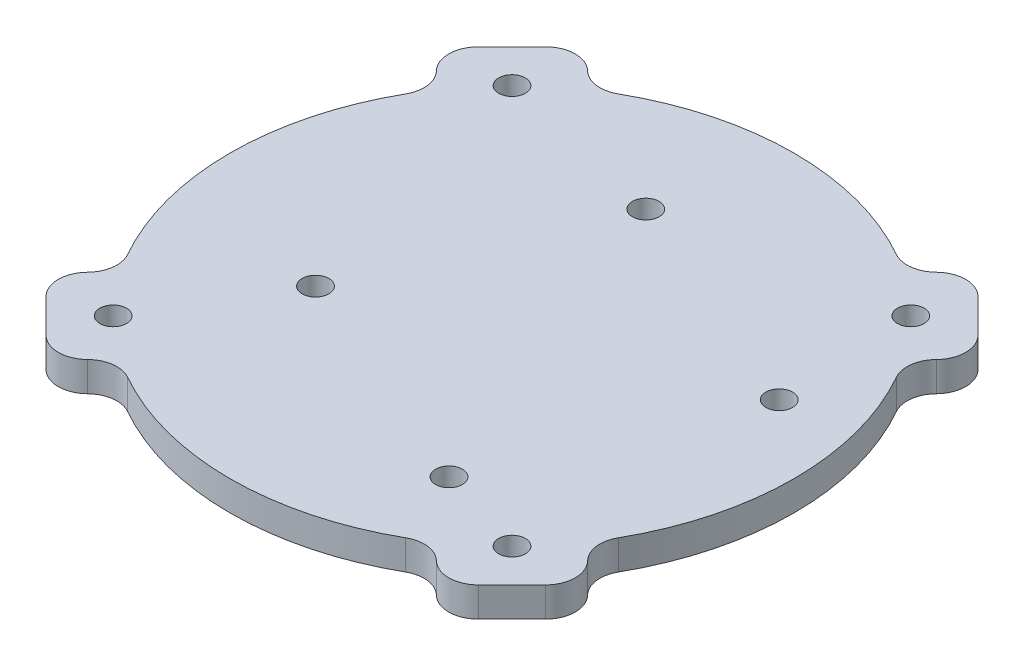
from build123d import *

# Parameters (mm, degrees)
SKETCH3_R           = 2.25
BOSS_EXTRUDE2_DEPTH = 5
FILLET2_R           = 5
SKETCH4_R           = 2.25
CUT_EXTRUDE1_DEPTH  = 68.360968075


with BuildPart() as part:
    # Sketch3 → Boss-Extrude2 (new body)
    with BuildSketch(Plane(origin=(0, 0, 0), x_dir=(1, 0, 0), z_dir=(0, 1, 0))):
        with BuildLine():
            Line((42.072853481, 36.415999231), (36.415999231, 42.072853481))
            ThreePointArc((36.415999231, 42.072853481), (32.880465325, 43.537319575), (29.344931419, 42.072853481))
            Line((29.344931419, 42.072853481), (26.615199056, 39.343121117))
            ThreePointArc((26.615199056, 39.343121117), (0, 47.5), (-26.615199056, 39.343121117))
            Line((-26.615199056, 39.343121117), (-29.344931419, 42.072853481))
            ThreePointArc((-29.344931419, 42.072853481), (-32.880465325, 43.537319575), (-36.415999231, 42.072853481))
            Line((-36.415999231, 42.072853481), (-42.072853481, 36.415999231))
            ThreePointArc((-42.072853481, 36.415999231), (-43.537319575, 32.880465325), (-42.072853481, 29.344931419))
            Line((-42.072853481, 29.344931419), (-39.343121117, 26.615199056))
            ThreePointArc((-39.343121117, 26.615199056), (-47.5, 0), (-39.343121117, -26.615199056))
            Line((-39.343121117, -26.615199056), (-42.072853481, -29.344931419))
            ThreePointArc((-42.072853481, -29.344931419), (-43.537319575, -32.880465325), (-42.072853481, -36.415999231))
            Line((-42.072853481, -36.415999231), (-36.415999231, -42.072853481))
            ThreePointArc((-36.415999231, -42.072853481), (-32.880465325, -43.537319575), (-29.344931419, -42.072853481))
            Line((-29.344931419, -42.072853481), (-26.615199056, -39.343121117))
            ThreePointArc((-26.615199056, -39.343121117), (0, -47.5), (26.615199056, -39.343121117))
            Line((26.615199056, -39.343121117), (29.344931419, -42.072853481))
            ThreePointArc((29.344931419, -42.072853481), (32.880465325, -43.537319575), (36.415999231, -42.072853481))
            Line((36.415999231, -42.072853481), (42.072853481, -36.415999231))
            ThreePointArc((42.072853481, -36.415999231), (43.537319575, -32.880465325), (42.072853481, -29.344931419))
            Line((42.072853481, -29.344931419), (39.343121117, -26.615199056))
            ThreePointArc((39.343121117, -26.615199056), (47.5, 0), (39.343121117, 26.615199056))
            Line((39.343121117, 26.615199056), (42.072853481, 29.344931419))
            ThreePointArc((42.072853481, 29.344931419), (43.537319575, 32.880465325), (42.072853481, 36.415999231))
        make_face()
        with Locations((33.587572106, 33.587572106)):
            Circle(SKETCH3_R, mode=Mode.SUBTRACT)
        with Locations((-33.587572106, 33.587572106)):
            Circle(SKETCH3_R, mode=Mode.SUBTRACT)
        with Locations((33.587572106, -33.587572106)):
            Circle(SKETCH3_R, mode=Mode.SUBTRACT)
        with Locations((-33.587572106, -33.587572106)):
            Circle(SKETCH3_R, mode=Mode.SUBTRACT)
    extrude(amount=BOSS_EXTRUDE2_DEPTH)

    # Fillet2
    fillet2_edges = [part.edges().sort_by_distance(p)[0] for p in [
        (26.615199056, 2.5, 39.343121117),
        (-26.615199056, 2.5, 39.343121117),
        (-39.343121117, 2.5, 26.615199056),
        (-39.343121117, 2.5, -26.615199056),
        (-26.615199056, 2.5, -39.343121117),
        (26.615199056, 2.5, -39.343121117),
        (39.343121117, 2.5, -26.615199056),
        (39.343121117, 2.5, 26.615199056),
    ]]
    fillet(fillet2_edges, radius=FILLET2_R)

    # Sketch4 → Cut-Extrude1 (cut, through all)
    with BuildSketch(Plane(origin=(0, 5, 0), x_dir=(1, 0, 0), z_dir=(0, 1, 0))):
        with Locations((-20.882726769, -12.213969589)):
            Circle(SKETCH4_R)
        with Locations((-4.308326491, 26.840982151)):
            Circle(SKETCH4_R)
        with Locations((34.746625249, 10.266581873)):
            Circle(SKETCH4_R)
        with Locations((18.172224972, -28.788369867)):
            Circle(SKETCH4_R)
    extrude(amount=-CUT_EXTRUDE1_DEPTH, mode=Mode.SUBTRACT)


solid = part.part
